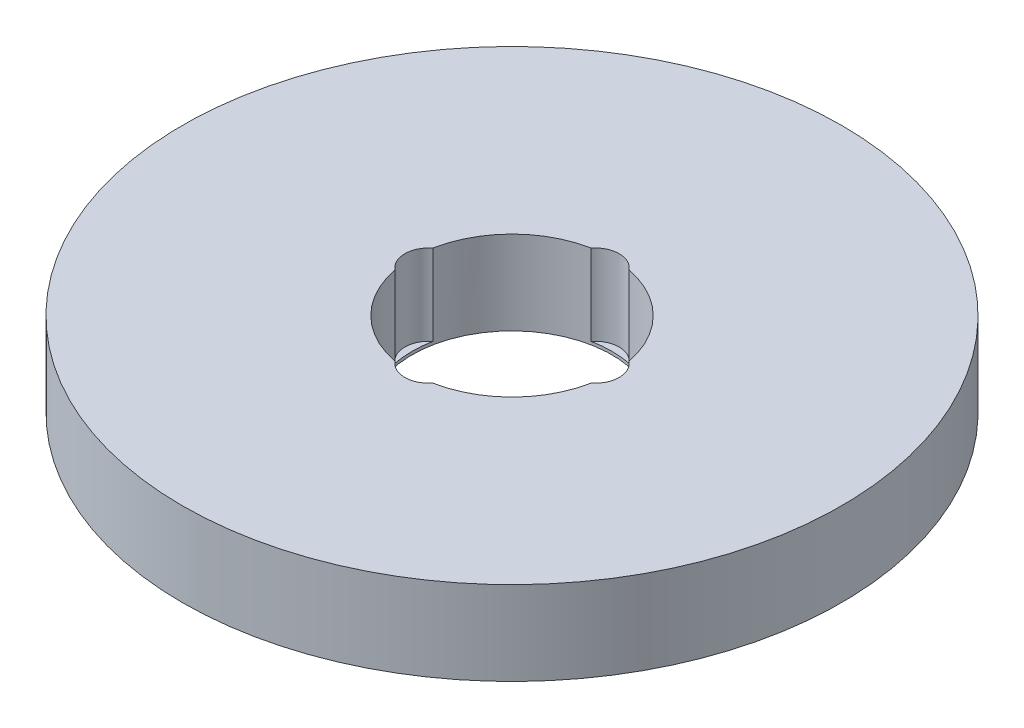
from build123d import *

# Parameters (mm, degrees)
SKETCH1_R           = 82.5
BOSS_EXTRUDE1_DEPTH = 21
SKETCH2_R           = 25
CUT_EXTRUDE1_DEPTH  = 119.547458851
SKETCH3_R           = 6.024795789
CUT_EXTRUDE2_DEPTH  = 20.236547791
CIRPATTERN1_COUNT   = 4


with BuildPart() as part:
    # Sketch1 → Boss-Extrude1 (new body)
    with BuildSketch(Plane(origin=(0, 0, 0), x_dir=(1, 0, 0), z_dir=(0, 1, 0))):
        Circle(SKETCH1_R)
    extrude(amount=BOSS_EXTRUDE1_DEPTH)

    # Sketch2 → Cut-Extrude1 (cut, through all)
    with BuildSketch(Plane(origin=(0, 0, 0), x_dir=(1, 0, 0), z_dir=(0, 1, 0))):
        Circle(SKETCH2_R)
    extrude(amount=CUT_EXTRUDE1_DEPTH, mode=Mode.SUBTRACT)

    # Sketch3 → Cut-Extrude2 (cut)
    with BuildSketch(Plane(origin=(0, 21, 0), x_dir=(1, 0, 0), z_dir=(0, 1, 0))):
        with Locations((-20.805054196, 0)):
            Circle(SKETCH3_R)
    cut_extrude2 = extrude(amount=-CUT_EXTRUDE2_DEPTH, mode=Mode.SUBTRACT)

    # CirPattern1: Cut-Extrude2 ×4 about axis
    cirpattern1_axis = Axis((0, 0, 0), (0, 1, 0))
    for i in range(1, CIRPATTERN1_COUNT):
        add(cut_extrude2.rotate(cirpattern1_axis, i * 360 / CIRPATTERN1_COUNT), mode=Mode.SUBTRACT)


solid = part.part
